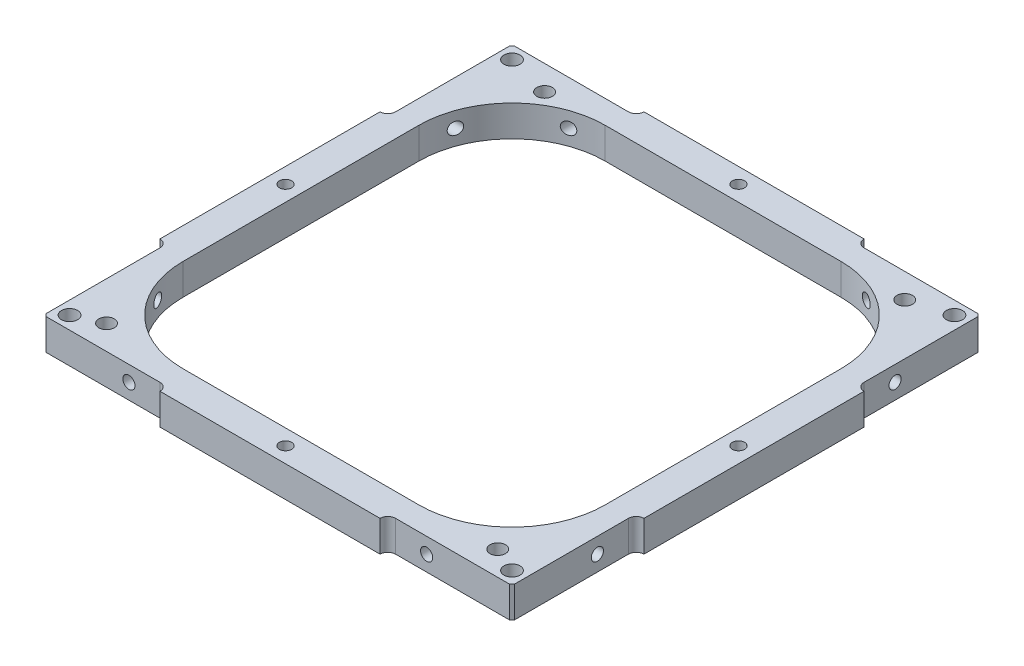
from build123d import *

# Parameters (mm, degrees)
BOSS_EXTRUDE1_DEPTH            = 6.35
CHAMFER1_SIZE                  = 0.508
FILLET1_R                      = 1.5875
M4X0_7_TAPPED_HOLE2_D          = 3.3
M3X0_5_TAPPED_HOLE1_AT_2_COUNT = 2
M3X0_5_TAPPED_HOLE1_AT_2_PITCH = 60.9
CIRPATTERN1_COUNT              = 4
SKETCH9_R                      = 1.5875
CUT_EXTRUDE2_DEPTH             = 71.290984486
CUT_EXTRUDE3_DEPTH             = 71.290984486
CIRPATTERN2_COUNT              = 4


with BuildPart() as part:
    # Sketch1 → Boss-Extrude1 (new body)
    with BuildSketch(Plane(origin=(0, 0, 0), x_dir=(1, 0, 0), z_dir=(0, 1, 0))):
        Polygon((-47.9125, 22.5125), (-49.5, 22.5125), (-49.5, -22.5125), (-47.9125, -22.5125), (-47.9125, -47.9125), (-22.5125, -47.9125), (-22.5125, -49.5), (22.5125, -49.5), (22.5125, -47.9125), (47.9125, -47.9125), (47.9125, -22.5125), (49.5, -22.5125), (49.5, 22.5125), (47.9125, 22.5125), (47.9125, 47.9125), (22.5125, 47.9125), (22.5125, 49.5), (-22.5125, 49.5), (-22.5125, 47.9125), (-47.9125, 47.9125), align=None)
    extrude(amount=BOSS_EXTRUDE1_DEPTH)

    # Chamfer1
    chamfer1_edges = [part.edges().sort_by_distance(p)[0] for p in [
        (-47.9125, 3.175, -47.9125),
        (47.9125, 3.175, -47.9125),
        (47.9125, 3.175, 47.9125),
        (-47.9125, 3.175, 47.9125),
    ]]
    chamfer(chamfer1_edges, length=CHAMFER1_SIZE)

    # Fillet1
    fillet1_edges = [part.edges().sort_by_distance(p)[0] for p in [
        (-47.9125, 3.175, -22.5125),
        (-22.5125, 3.175, -47.9125),
        (22.5125, 3.175, -47.9125),
        (47.9125, 3.175, -22.5125),
        (47.9125, 3.175, 22.5125),
        (22.5125, 3.175, 47.9125),
        (-22.5125, 3.175, 47.9125),
        (-47.9125, 3.175, 22.5125),
    ]]
    fillet(fillet1_edges, radius=FILLET1_R - 0.0001)  # a hair under: the kernel refuses the full size

    # M4x0.7 Tapped Hole2 (through all)
    with Locations(Plane(origin=(0, 0, 0), x_dir=(-1, 0, 0), z_dir=(0, -1, 0))):
        with Locations((-45.25, 45.25), (45.25, 45.25), (45.25, -45.25), (-45.25, -45.25)):
            Hole(M4X0_7_TAPPED_HOLE2_D / 2)

    # Sketch7 → M3x0.5 Tapped Hole1 (revolve, cut)
    with BuildSketch(Plane(origin=(-30.45, 3.175, 47.9125), x_dir=(0, -1, 0), z_dir=(1, 0, 0))):
        Polygon((0, 0), (0, 8.371075774), (1.25, 7.62), (1.25, 0), align=None)
    m3x0_5_tapped_hole1 = revolve(axis=Axis((-30.45, 3.175, 54.2625), (0, 0, -1)), mode=Mode.SUBTRACT)

    # M3x0.5 Tapped Hole1 at 2: M3x0.5 Tapped Hole1 ×2
    with Locations(*[(i * M3X0_5_TAPPED_HOLE1_AT_2_PITCH, 0, 0) for i in range(1, M3X0_5_TAPPED_HOLE1_AT_2_COUNT)]):
        add(m3x0_5_tapped_hole1, mode=Mode.SUBTRACT)

    # CirPattern1: M3x0.5 Tapped Hole1 ×4 about axis
    cirpattern1_axis = Axis((0, -0.3175, 0), (0, 1, 0))
    for i in range(1, CIRPATTERN1_COUNT):
        add(m3x0_5_tapped_hole1.rotate(cirpattern1_axis, i * 360 / CIRPATTERN1_COUNT), mode=Mode.SUBTRACT)

    # CirPattern1 copy 1 sketch → CirPattern1 copy 1 (revolve, cut)
    with BuildSketch(Plane(origin=(47.9125, 3.175, -30.45), x_dir=(0, -1, 0), z_dir=(0, 0, -1))):
        Polygon((0, 0), (0, 8.371075774), (1.25, 7.62), (1.25, 0), align=None)
    revolve(axis=Axis((54.2625, 3.175, -30.45), (-1, 0, 0)), mode=Mode.SUBTRACT)

    # CirPattern1 copy 2 sketch → CirPattern1 copy 2 (revolve, cut)
    with BuildSketch(Plane(origin=(-30.45, 3.175, -47.9125), x_dir=(0, -1, 0), z_dir=(-1, 0, 0))):
        Polygon((0, 0), (0, 8.371075774), (1.25, 7.62), (1.25, 0), align=None)
    revolve(axis=Axis((-30.45, 3.175, -54.2625), (0, 0, 1)), mode=Mode.SUBTRACT)

    # CirPattern1 copy 3 sketch → CirPattern1 copy 3 (revolve, cut)
    with BuildSketch(Plane(origin=(-47.9125, 3.175, 30.45), x_dir=(0, -1, 0), z_dir=(0, 0, 1))):
        Polygon((0, 0), (0, 8.371075774), (1.25, 7.62), (1.25, 0), align=None)
    revolve(axis=Axis((-54.2625, 3.175, 30.45), (1, 0, 0)), mode=Mode.SUBTRACT)

    # Sketch9 → Cut-Extrude2 (cut, through all)
    with BuildSketch(Plane(origin=(0, 6.35, 0), x_dir=(1, 0, 0), z_dir=(0, 1, 0))):
        with Locations(Location((-40.005, -42.926, 0), (0, 0, 270))):
            Circle(SKETCH9_R)
        with Locations(Location((40.005, -42.926, 0), (0, 0, 270))):
            Circle(SKETCH9_R)
        with Locations(Location((37.465, 42.8625, 0), (0, 0, 270))):
            Circle(SKETCH9_R)
        with Locations(Location((-36.195, 42.8625, 0), (0, 0, 270))):
            Circle(SKETCH9_R)
    extrude(amount=-CUT_EXTRUDE2_DEPTH, mode=Mode.SUBTRACT)

    # Sketch15 → M3x0.5 Tapped Hole3 (revolve, cut)
    with BuildSketch(Plane(origin=(0, 6.35, 46.325), x_dir=(0, 0, 1), z_dir=(1, 0, 0))):
        Polygon((0, 0), (0, 8.371075774), (1.25, 7.62), (1.25, 0), align=None)
    m3x0_5_tapped_hole3 = revolve(axis=Axis((0, 12.7, 46.325), (0, -1, 0)), mode=Mode.SUBTRACT)

    # Sketch16 → Cut-Extrude3 (cut, through all)
    with BuildSketch(Plane(origin=(0, 6.35, 0), x_dir=(1, 0, 0), z_dir=(0, 1, 0))):
        with BuildLine():
            ThreePointArc((-43.15, -24.1), (-37.570384182, -37.570384182), (-24.1, -43.15))
            Line((-24.1, -43.15), (24.1, -43.15))
            ThreePointArc((24.1, -43.15), (37.570384182, -37.570384182), (43.15, -24.1))
            Line((43.15, -24.1), (43.15, 24.1))
            ThreePointArc((43.15, 24.1), (37.570384182, 37.570384182), (24.1, 43.15))
            Line((24.1, 43.15), (-24.1, 43.15))
            ThreePointArc((-24.1, 43.15), (-37.570384182, 37.570384182), (-43.15, 24.1))
            Line((-43.15, 24.1), (-43.15, -24.1))
        make_face()
    extrude(amount=-CUT_EXTRUDE3_DEPTH, mode=Mode.SUBTRACT)

    # CirPattern2: M3x0.5 Tapped Hole3 ×4 about axis
    cirpattern2_axis = Axis((0, 0, 0), (0, 1, 0))
    for i in range(1, CIRPATTERN2_COUNT):
        add(m3x0_5_tapped_hole3.rotate(cirpattern2_axis, i * 360 / CIRPATTERN2_COUNT), mode=Mode.SUBTRACT)


solid = part.part
